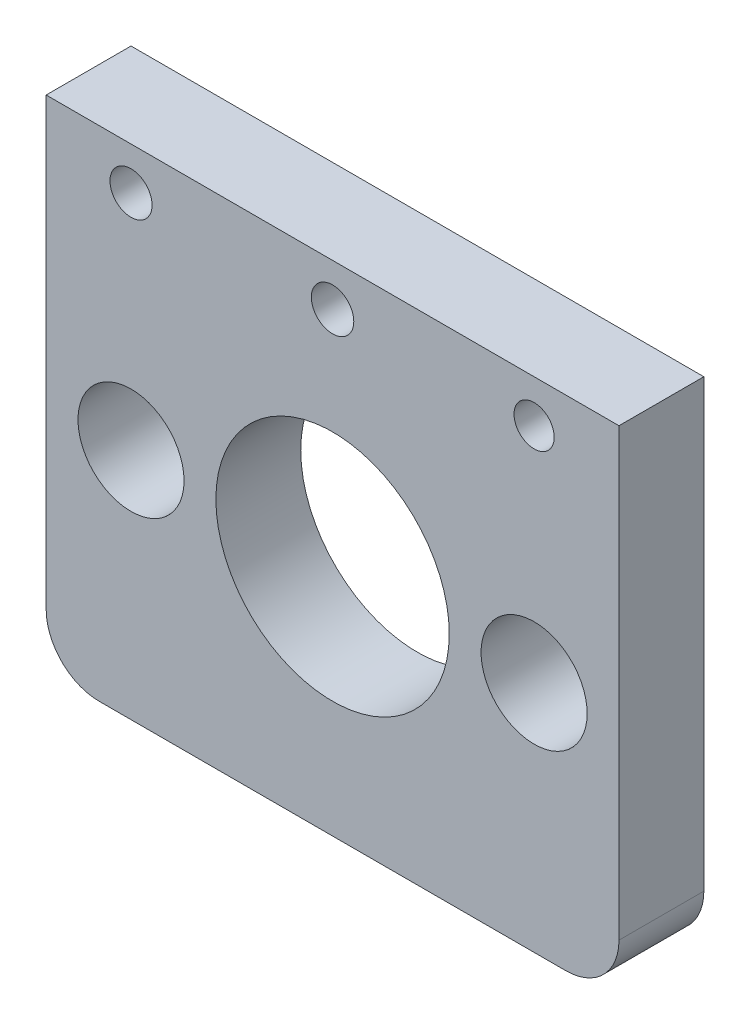
from build123d import *

# Parameters (mm, degrees)
SKETCH1_R           = 5
SKETCH1_R_2         = 11
SKETCH1_R_3         = 2
SKETCH1_R_4         = 1.984633097
SKETCH1_R_5         = 1.894356903
BOSS_EXTRUDE1_DEPTH = 8


with BuildPart() as part:
    # Sketch1 → Boss-Extrude1 (new body)
    with BuildSketch(Plane.XY):
        with BuildLine():
            Line((-22, -22), (22, -22))
            ThreePointArc((22, -22), (25.535533906, -20.535533906), (27, -17))
            Line((27, -17), (27, 25))
            Line((27, 25), (-27, 25))
            Line((-27, 25), (-27, -17))
            ThreePointArc((-27, -17), (-25.535533906, -20.535533906), (-22, -22))
        make_face()
        with Locations((-19, 0)):
            Circle(SKETCH1_R, mode=Mode.SUBTRACT)
        with Locations((19, 0)):
            Circle(SKETCH1_R, mode=Mode.SUBTRACT)
        Circle(SKETCH1_R_2, mode=Mode.SUBTRACT)
        with Locations((0, 21)):
            Circle(SKETCH1_R_3, mode=Mode.SUBTRACT)
        with Locations((-19, 21)):
            Circle(SKETCH1_R_4, mode=Mode.SUBTRACT)
        with Locations((19, 21)):
            Circle(SKETCH1_R_5, mode=Mode.SUBTRACT)
    extrude(amount=BOSS_EXTRUDE1_DEPTH)


solid = part.part
